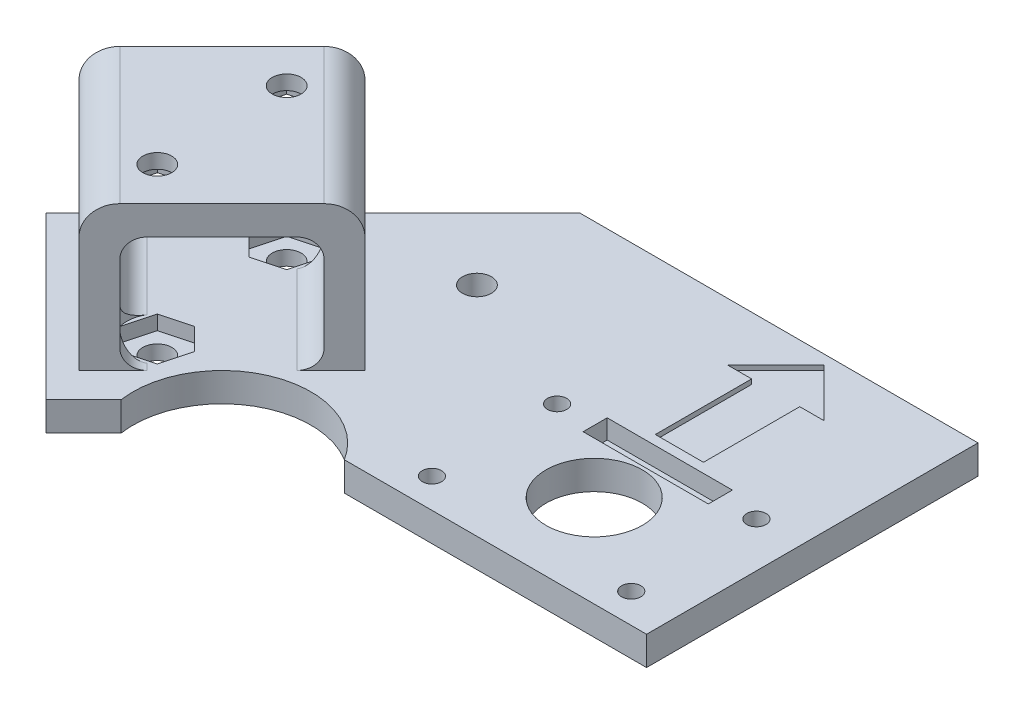
from build123d import *

# Parameters (mm, degrees)
BOSS_EXTRUDE1_DEPTH       = 3
BOSS_EXTRUDE2_DEPTH       = 15
FILLET1_R                 = 3
SKETCH4_W                 = 15
SKETCH4_H                 = 9
SKETCH4_H_2               = 3
CUT_EXTRUDE1_DEPTH        = 135.512351943
FILLET2_R                 = 2
FILLET4_R                 = 2
SKETCH6_R                 = 1.5
CUT_EXTRUDE2_DEPTH        = 3
SKETCH25_R                = 1.5
CUT_EXTRUDE16_DEPTH       = 3
SKETCH7_R                 = 1.5
CUT_EXTRUDE3_DEPTH        = 3
CIRPATTERN1_START         = -3.2499999
CIRPATTERN1_OUTLINE_W     = 20
CIRPATTERN1_OUTLINE_H     = 3
CIRPATTERN1_DEPTH         = 6.4999998
CIRPATTERN1_START_2       = 6.25
CIRPATTERN1_2_OUTLINE_W   = 20
CIRPATTERN1_2_OUTLINE_H   = 3
CIRPATTERN1_2_DEPTH       = 1.25
CIRPATTERN1_START_3       = -7.5
CIRPATTERN1_3_OUTLINE_W   = 20
CIRPATTERN1_3_OUTLINE_H   = 3
CIRPATTERN1_3_DEPTH       = 1.2499999
CIRPATTERN1_START_4       = -10.5
CIRPATTERN1_4_OUTLINE_W   = 20
CIRPATTERN1_4_OUTLINE_H   = 3
CIRPATTERN1_4_DEPTH       = 21
CIRPATTERN1_START_5       = 43.5
CIRPATTERN1_5_OUTLINE_W   = 3.0000002
CIRPATTERN1_5_OUTLINE_H   = 3
CIRPATTERN1_5_OUTLINE_W_2 = 3.0000001
CIRPATTERN1_5_DEPTH       = 20
CIRPATTERN1_6_DEPTH       = 20
CIRPATTERN1_START_6       = -63.5
CIRPATTERN1_7_DEPTH       = 20
CIRPATTERN1_8_DEPTH       = 20
CIRPATTERN1_START_7       = -64
CIRPATTERN1_9_DEPTH       = 128
CIRPATTERN1_START_8       = 15
CIRPATTERN1_10_OUTLINE_R  = 1.5
CIRPATTERN1_10_DEPTH      = 3
CIRPATTERN6_COUNT         = 4
SKETCH8_W                 = 5
SKETCH8_H                 = 10
CUT_EXTRUDE4_DEPTH        = 0.5
SKETCH11_R                = 5
CUT_EXTRUDE6_DEPTH        = 92.046691318
SKETCH12_R                = 1
CUT_EXTRUDE7_DEPTH        = 92.046691318
SKETCH26_W                = 13
SKETCH26_H                = 2.5
CUT_EXTRUDE17_DEPTH       = 2
SKETCH13_W                = 117
SKETCH13_H                = 5
SKETCH13_W_2              = 5
SKETCH13_H_2              = 52.605122422
BOSS_EXTRUDE3_DEPTH       = 6.6
SKETCH14_W                = 5
SKETCH14_H                = 5
BOSS_EXTRUDE4_DEPTH       = 8.5
SKETCH15_W                = 3
SKETCH15_H                = 5
BOSS_EXTRUDE5_DEPTH       = 5
SKETCH16_R                = 1.5
CUT_EXTRUDE8_DEPTH        = 5
FILLET3_R                 = 1
SKETCH17_R                = 2.5
BOSS_EXTRUDE6_DEPTH       = 5
SKETCH18_R                = 1.5
CUT_EXTRUDE9_DEPTH        = 97.520723163
CUT_EXTRUDE10_REACH       = 98.48
SKETCH19_W                = 20
SKETCH19_H                = 50
SKETCH20_R                = 1.5
CUT_EXTRUDE11_DEPTH       = 98.16609491
CUT_EXTRUDE12_DEPTH       = 98.16609491
CUT_EXTRUDE13_DEPTH       = 98.16609491
CUT_EXTRUDE13_DEPTH_BACK  = 98.16609491
SKETCH22_R                = 9.231493399
CUT_EXTRUDE18_DEPTH       = 98.67420335
CUT_EXTRUDE18_DEPTH_BACK  = 98.67420335
SKETCH28_R                = 1.5
CUT_EXTRUDE19_DEPTH       = 1.5
SKETCH23_R                = 1.5
CUT_EXTRUDE14_DEPTH       = 3
CUT_EXTRUDE20_DEPTH       = 1.5
SKETCH24_R                = 3.175426481
CUT_EXTRUDE15_DEPTH       = 3
CUT_EXTRUDE21_START       = -1.5
CUT_EXTRUDE21_DEPTH       = 2.5
CUT_EXTRUDE22_DEPTH       = 1.5
SKETCH33_R                = 3.175426481
CUT_EXTRUDE23_DEPTH       = 3
CUT_EXTRUDE24_START       = -1.5
CUT_EXTRUDE24_DEPTH       = 2.5
CIRPATTERN10_COUNT        = 4
CUT_EXTRUDE25_DEPTH       = 1.5
CUT_EXTRUDE26_DEPTH       = 1.5
CUT_EXTRUDE27_DEPTH       = 2.5
CUT_EXTRUDE28_DEPTH       = 98.67420335
CUT_EXTRUDE28_DEPTH_BACK  = 98.67420335
SKETCH37_R                = 1.5


with BuildPart() as part:
    # Sketch2 → Boss-Extrude1 (new body)
    with BuildSketch(Plane(origin=(0, 0, 0), x_dir=(1, 0, 0), z_dir=(0, 1, 0))):
        Polygon((26.302561211, -63.5), (63.5, -26.302561211), (63.5, 26.302561211), (26.302561211, 63.5), (-26.302561211, 63.5), (-63.5, 26.302561211), (-63.5, -26.302561211), (-26.302561211, -63.5), align=None)
    extrude(amount=BOSS_EXTRUDE1_DEPTH)

    # Sketch3 → Boss-Extrude2 (add)
    with BuildSketch(Plane(origin=(0, 3, 0), x_dir=(1, 0, 0), z_dir=(0, 1, 0))):
        Polygon((-52.325901808, -37.476659403), (-37.476659403, -52.325901808), (-23.334523779, -38.183766184), (-38.183766184, -23.334523779), align=None)
    extrude(amount=BOSS_EXTRUDE2_DEPTH)

    # Fillet1
    fillet1_edges = [part.edges().sort_by_distance(p)[0] for p in [
        (-45.254833996, 18, 30.405591591),
        (-30.405591591, 18, 45.254833996),
    ]]
    fillet(fillet1_edges, radius=FILLET1_R)

    # Sketch4 → Cut-Extrude1 (cut, through all)
    with BuildSketch(Plane(origin=(-30.759144982, 0, 30.759144982), x_dir=(-0.7071067811865479, 0, -0.7071067811865472), z_dir=(0.7071067811865472, 0, -0.7071067811865479))):
        with Locations((0, 10.5)):
            Rectangle(SKETCH4_W, SKETCH4_H)
        with Locations((0, 4.5)):
            Rectangle(SKETCH4_W, SKETCH4_H_2)
    extrude(amount=-CUT_EXTRUDE1_DEPTH, mode=Mode.SUBTRACT)

    # Fillet2
    fillet2_edges = [part.edges().sort_by_distance(p)[0] for p in [
        (-32.526911935, 3, 43.133513652),
        (-43.133513652, 3, 32.526911935),
    ]]
    fillet(fillet2_edges, radius=FILLET2_R)

    # Fillet4
    fillet4_edges = [part.edges().sort_by_distance(p)[0] for p in [
        (-32.526911935, 15, 43.133513652),
        (-43.133513652, 15, 32.526911935),
    ]]
    fillet(fillet4_edges, radius=FILLET4_R)

    # Sketch6 → Cut-Extrude2 (cut)
    with BuildSketch(Plane(origin=(7.424621202, 0, 7.424621202), x_dir=(0.7071067811865472, 0, -0.7071067811865478), z_dir=(0.7071067811865478, 0, 0.7071067811865472))):
        with Locations((-58.5, 10.5)):
            Circle(SKETCH6_R)
    cut_extrude2 = extrude(amount=-CUT_EXTRUDE2_DEPTH, mode=Mode.SUBTRACT)

    # Sketch25 → Cut-Extrude16 (cut)
    with BuildSketch(Plane(origin=(-7.424621202, 0, -7.424621202), x_dir=(-0.7071067811865471, 0, 0.7071067811865479), z_dir=(-0.7071067811865479, 0, -0.7071067811865471))):
        with Locations((48.5, 10.5)):
            Circle(SKETCH25_R)
    cut_extrude16 = extrude(amount=-CUT_EXTRUDE16_DEPTH, mode=Mode.SUBTRACT)

    # Sketch7 → Cut-Extrude3 (cut)
    with BuildSketch(Plane(origin=(0, 18, 0), x_dir=(1, 0, 0), z_dir=(0, 1, 0))):
        with Locations(Location((-44.72450391, -38.006989489, 0), (0, 0, 270))):
            Circle(SKETCH7_R)
        with Locations(Location((-30.935921677, -37.653436098, 0), (0, 0, 270))):
            Circle(SKETCH7_R)
    extrude(amount=-CUT_EXTRUDE3_DEPTH, mode=Mode.SUBTRACT)



with BuildPart() as body_2:
    # CirPattern1: read off the stored shape, not the designer's step
    # CirPattern1 outline → CirPattern1 (new body)
    with BuildSketch(Plane(origin=(0, 0, 0), x_dir=(0.707106781186549, 0, -0.707106781186546), z_dir=(0.707106781186546, 0, 0.707106781186549)).offset(CIRPATTERN1_START)):
        with Locations((53.5, 16.5)):
            Rectangle(CIRPATTERN1_OUTLINE_W, CIRPATTERN1_OUTLINE_H)
    extrude(amount=CIRPATTERN1_DEPTH)



with BuildPart() as body_3:
    # CirPattern1 2 outline → CirPattern1 2 (new body)
    with BuildSketch(Plane(origin=(0, 0, 0), x_dir=(0.707106781186549, 0, -0.707106781186546), z_dir=(0.707106781186546, 0, 0.707106781186549)).offset(CIRPATTERN1_START_2)):
        with Locations((53.5, 16.5)):
            Rectangle(CIRPATTERN1_2_OUTLINE_W, CIRPATTERN1_2_OUTLINE_H)
    extrude(amount=CIRPATTERN1_2_DEPTH)


with BuildPart() as body_4:
    # CirPattern1 3 outline → CirPattern1 3 (new body)
    with BuildSketch(Plane(origin=(0, 0, 0), x_dir=(0.707106781186549, 0, -0.707106781186546), z_dir=(0.707106781186546, 0, 0.707106781186549)).offset(CIRPATTERN1_START_3)):
        with Locations((53.5, 16.5)):
            Rectangle(CIRPATTERN1_3_OUTLINE_W, CIRPATTERN1_3_OUTLINE_H)
    extrude(amount=CIRPATTERN1_3_DEPTH)


with BuildPart() as body_5:
    # CirPattern1 4 outline → CirPattern1 4 (new body)
    with BuildSketch(Plane(origin=(0, 0, 0), x_dir=(0.707106781186548, 0, 0.707106781186547), z_dir=(0.707106781186547, 0, -0.707106781186548)).offset(CIRPATTERN1_START_4)):
        with Locations((53.5, -16.5)):
            Rectangle(CIRPATTERN1_4_OUTLINE_W, CIRPATTERN1_4_OUTLINE_H)
        with Locations((-53.5, -16.5)):
            Rectangle(CIRPATTERN1_4_OUTLINE_W, CIRPATTERN1_4_OUTLINE_H)
    extrude(amount=CIRPATTERN1_4_DEPTH)


with BuildPart() as body_2_1:
    add(body_2.part)

    add(body_3.part)  # CirPattern1 5 merges body 3

    add(body_4.part)  # CirPattern1 5 merges body 4
    # CirPattern1 5 outline → CirPattern1 5 (add)
    with BuildSketch(Plane(origin=(0, 0, 0), x_dir=(0.707106781186548, 0, 0.707106781186547), z_dir=(0.707106781186547, 0, -0.707106781186548)).offset(CIRPATTERN1_START_5)):
        with Locations((-4.75, -16.5)):
            Rectangle(CIRPATTERN1_5_OUTLINE_W, CIRPATTERN1_5_OUTLINE_H)
        with Locations((4.74999995, -16.5)):
            Rectangle(CIRPATTERN1_5_OUTLINE_W_2, CIRPATTERN1_5_OUTLINE_H)
    extrude(amount=CIRPATTERN1_5_DEPTH)


with BuildPart() as part_1:
    add(part.part)

    add(body_2_1.part)  # CirPattern1 6 merges body 2
    # CirPattern1 6 outline → CirPattern1 6 (add)
    with BuildSketch(Plane(origin=(0, 0, 0), x_dir=(0.707106781186548, 0, 0.707106781186547), z_dir=(0.707106781186547, 0, -0.707106781186548)).offset(CIRPATTERN1_START_5)):
        with BuildLine():
            Line((-10.5, -3), (-10.5, -15))
            ThreePointArc((-10.5, -15), (-9.621320344, -17.121320344), (-7.5, -18))
            Line((-7.5, -18), (-7.5, -15))
            Line((-7.5, -15), (-5.5, -15))
            ThreePointArc((-5.5, -15), (-6.914213562, -14.414213562), (-7.5, -13))
            Line((-7.5, -13), (-7.5, -5))
            ThreePointArc((-7.5, -5), (-6.914213562, -3.585786438), (-5.5, -3))
            Line((-5.5, -3), (-10.5, -3))
        make_face()
        with BuildLine():
            Line((7.5, -15), (7.5, -18))
            ThreePointArc((7.5, -18), (9.621320344, -17.121320344), (10.5, -15))
            Line((10.5, -15), (10.5, -3))
            Line((10.5, -3), (5.5, -3))
            ThreePointArc((5.5, -3), (6.914213562, -3.585786438), (7.5, -5))
            Line((7.5, -5), (7.5, -13))
            ThreePointArc((7.5, -13), (6.914213562, -14.414213562), (5.5, -15))
            Line((5.5, -15), (7.5, -15))
        make_face()
    extrude(amount=CIRPATTERN1_6_DEPTH)


    add(body_5.part)  # CirPattern1 7 merges body 5
    # CirPattern1 7 outline → CirPattern1 7 (add)
    with BuildSketch(Plane(origin=(0, 0, 0), x_dir=(0.707106781186549, 0, -0.707106781186546), z_dir=(0.707106781186546, 0, 0.707106781186549)).offset(CIRPATTERN1_START_6)):
        with BuildLine():
            Line((10.5, 3), (10.5, 15))
            Line((10.5, 15), (5.5, 15))
            ThreePointArc((5.5, 15), (6.914213562, 14.414213562), (7.5, 13))
            Line((7.5, 13), (7.5, 5))
            ThreePointArc((7.5, 5), (6.914213562, 3.585786438), (5.5, 3))
            Line((5.5, 3), (10.5, 3))
        make_face()
        with BuildLine():
            Line((-10.5, 3), (-5.5, 3))
            ThreePointArc((-5.5, 3), (-6.914213562, 3.585786438), (-7.5, 5))
            Line((-7.5, 5), (-7.5, 13))
            ThreePointArc((-7.5, 13), (-6.914213562, 14.414213562), (-5.5, 15))
            Line((-5.5, 15), (-10.5, 15))
            Line((-10.5, 15), (-10.5, 3))
        make_face()
    extrude(amount=CIRPATTERN1_7_DEPTH)

    # CirPattern1 8 outline → CirPattern1 8 (add)
    with BuildSketch(Plane(origin=(0, 0, 0), x_dir=(0.707106781186549, 0, -0.707106781186546), z_dir=(0.707106781186546, 0, 0.707106781186549)).offset(CIRPATTERN1_START_5)):
        with BuildLine():
            Line((10.5, 3), (10.5, 15))
            Line((10.5, 15), (5.5, 15))
            ThreePointArc((5.5, 15), (6.914213562, 14.414213562), (7.5, 13))
            Line((7.5, 13), (7.5, 5))
            ThreePointArc((7.5, 5), (6.914213562, 3.585786438), (5.5, 3))
            Line((5.5, 3), (10.5, 3))
        make_face()
        with BuildLine():
            Line((-10.5, 3), (-5.5, 3))
            ThreePointArc((-5.5, 3), (-6.914213562, 3.585786438), (-7.5, 5))
            Line((-7.5, 5), (-7.5, 13))
            ThreePointArc((-7.5, 13), (-6.914213562, 14.414213562), (-5.5, 15))
            Line((-5.5, 15), (-10.5, 15))
            Line((-10.5, 15), (-10.5, 3))
        make_face()
    extrude(amount=CIRPATTERN1_8_DEPTH)

    # CirPattern1 9 outline → CirPattern1 9 (cut)
    with BuildSketch(Plane(origin=(0, 0, 0), x_dir=(0.707106781186549, 0, -0.707106781186546), z_dir=(0.707106781186546, 0, 0.707106781186549)).offset(CIRPATTERN1_START_7)):
        with BuildLine():
            ThreePointArc((7.5, 18), (9.621320344, 17.121320344), (10.5, 15))
            Line((10.5, 15), (10.5, 18))
            Line((10.5, 18), (7.5, 18))
        make_face()
        with BuildLine():
            ThreePointArc((-10.5, 15), (-9.621320344, 17.121320344), (-7.5, 18))
            Line((-7.5, 18), (-10.5, 18))
            Line((-10.5, 18), (-10.5, 15))
        make_face()
    extrude(amount=CIRPATTERN1_9_DEPTH, mode=Mode.SUBTRACT)

    # CirPattern1 10 outline → CirPattern1 10 (cut)
    with BuildSketch(Plane(origin=(0, 0, 0), x_dir=(1, 0, 0), z_dir=(0, 1, 0)).offset(CIRPATTERN1_START_8)):
        with Locations((38.006989489, -44.72450391)):
            Circle(CIRPATTERN1_10_OUTLINE_R)
        with Locations((37.653436098, -30.935921677)):
            Circle(CIRPATTERN1_10_OUTLINE_R)
        with Locations((44.72450391, 38.006989489)):
            Circle(CIRPATTERN1_10_OUTLINE_R)
        with Locations((30.935921677, 37.653436098)):
            Circle(CIRPATTERN1_10_OUTLINE_R)
        with Locations((-38.006989489, 44.72450391)):
            Circle(CIRPATTERN1_10_OUTLINE_R)
        with Locations((-37.653436098, 30.935921677)):
            Circle(CIRPATTERN1_10_OUTLINE_R)
    extrude(amount=CIRPATTERN1_10_DEPTH, mode=Mode.SUBTRACT)

    # CirPattern6: Cut-Extrude2, Cut-Extrude16 ×4 about axis
    cirpattern6_axis = Axis((0, 0, 0), (0, 1, 0))
    add([cut_extrude2.rotate(cirpattern6_axis, i * 360 / CIRPATTERN6_COUNT) for i in range(1, CIRPATTERN6_COUNT)], mode=Mode.SUBTRACT)
    add([cut_extrude16.rotate(cirpattern6_axis, i * 360 / CIRPATTERN6_COUNT) for i in range(1, CIRPATTERN6_COUNT)], mode=Mode.SUBTRACT)

    # Sketch8 → Cut-Extrude4 (cut)
    with BuildSketch(Plane(origin=(0, 3, 0), x_dir=(1, 0, 0), z_dir=(0, 1, 0))):
        with Locations((0, 52.5)):
            Rectangle(SKETCH8_W, SKETCH8_H)
        Polygon((-5, 57.5), (5, 57.5), (0, 62.5), align=None)
    extrude(amount=-CUT_EXTRUDE4_DEPTH, mode=Mode.SUBTRACT)

    # Sketch11 → Cut-Extrude6 (cut, through all)
    with BuildSketch(Plane(origin=(0, 3, 0), x_dir=(1, 0, 0), z_dir=(0, 1, 0))):
        with Locations(Location((0, 38.65, 0), (0, 0, 270))):
            Circle(SKETCH11_R)
    extrude(amount=-CUT_EXTRUDE6_DEPTH, mode=Mode.SUBTRACT)

    # Sketch12 → Cut-Extrude7 (cut, through all)
    with BuildSketch(Plane(origin=(0, 3, 0), x_dir=(1, 0, 0), z_dir=(0, 1, 0))):
        with Locations(Location((-10.35, 45.15, 0), (0, 0, 270))):
            Circle(SKETCH12_R)
        with Locations(Location((10.35, 45.15, 0), (0, 0, 90))):
            Circle(SKETCH12_R)
        with Locations(Location((-10.35, 32.15, 0), (0, 0, 270))):
            Circle(SKETCH12_R)
        with Locations(Location((10.35, 32.15, 0), (0, 0, 90))):
            Circle(SKETCH12_R)
    extrude(amount=-CUT_EXTRUDE7_DEPTH, mode=Mode.SUBTRACT)

    # Sketch26 → Cut-Extrude17 (cut)
    with BuildSketch(Plane(origin=(0, 3, 0), x_dir=(1, 0, 0), z_dir=(0, 1, 0))):
        with Locations((0, 45.25)):
            Rectangle(SKETCH26_W, SKETCH26_H)
    extrude(amount=-CUT_EXTRUDE17_DEPTH, mode=Mode.SUBTRACT)

    # Sketch13 → Boss-Extrude3 (add)
    with BuildSketch(Plane(origin=(0, 3, 0), x_dir=(1, 0, 0), z_dir=(0, 1, 0))):
        with Locations((0, -12.5)):
            Rectangle(SKETCH13_W, SKETCH13_H)
        with Locations((-61, 0)):
            Rectangle(SKETCH13_W_2, SKETCH13_H_2)
        with Locations((0, 12.5)):
            Rectangle(SKETCH13_W, SKETCH13_H)
        with Locations((61, 0)):
            Rectangle(SKETCH13_W_2, SKETCH13_H_2)
    extrude(amount=BOSS_EXTRUDE3_DEPTH)

    # Sketch14 → Boss-Extrude4 (add)
    with BuildSketch(Plane(origin=(63.5, 0, 0), x_dir=(0, 0, -1), z_dir=(1, 0, 0))):
        with Locations((0, 7.1)):
            Rectangle(SKETCH14_W, SKETCH14_H)
    extrude(amount=BOSS_EXTRUDE4_DEPTH)

    # Sketch15 → Boss-Extrude5 (add)
    with BuildSketch(Plane(origin=(0, 9.6, 0), x_dir=(1, 0, 0), z_dir=(0, 1, 0))):
        with Locations((70.5, 0)):
            Rectangle(SKETCH15_W, SKETCH15_H)
    extrude(amount=BOSS_EXTRUDE5_DEPTH)

    # Sketch16 → Cut-Extrude8 (cut)
    with BuildSketch(Plane.ZY.offset(63.5)):
        with Locations((-5, 5.8)):
            Circle(SKETCH16_R)
        with Locations(Location((5, 5.8, 0), (0, 0, 180))):
            Circle(SKETCH16_R)
    extrude(amount=-CUT_EXTRUDE8_DEPTH, mode=Mode.SUBTRACT)

    # Fillet3
    fillet3_edges = [part_1.edges().sort_by_distance(p)[0] for p in [
        (0, 9.6, -15),
        (-58.5, 9.6, -20.651280605),
        (-61, 9.6, -26.302561211),
        (-58.5, 9.6, 20.651280605),
        (61, 9.6, 26.302561211),
        (63.5, 9.6, -14.401280605),
        (-58.5, 9.6, 0),
        (0, 9.6, 10),
        (0, 9.6, -10),
        (58.5, 9.6, 0),
        (-63.5, 9.6, 0),
        (-61, 9.6, 26.302561211),
        (0, 9.6, 15),
        (58.5, 9.6, 20.651280605),
        (61, 9.6, -26.302561211),
        (58.5, 9.6, -20.651280605),
        (63.5, 9.6, 14.401280605),
        (63.5, 7.1, -2.5),
        (67.75, 4.6, -2.5),
        (63.5, 7.1, 2.5),
        (63.5, 4.6, 0),
        (67.75, 4.6, 2.5),
        (72, 9.6, -2.5),
        (72, 9.6, 2.5),
        (72, 4.6, 0),
        (66.25, 9.6, 2.5),
        (66.25, 9.6, -2.5),
        (69, 9.6, 0),
        (69, 12.1, -2.5),
        (69, 12.1, 2.5),
        (72, 14.6, 0),
        (70.5, 14.6, -2.5),
        (69, 14.6, 0),
        (70.5, 14.6, 2.5),
    ]]
    fillet(fillet3_edges, radius=FILLET3_R)

    # Sketch17 → Boss-Extrude6 (add)
    with BuildSketch(Plane(origin=(0, 3, 0), x_dir=(1, 0, 0), z_dir=(0, 1, 0))):
        with Locations(Location((-15, -31, 0), (0, 0, 270))):
            Circle(SKETCH17_R)
        with Locations(Location((-15, -61, 0), (0, 0, 270))):
            Circle(SKETCH17_R)
        with Locations(Location((15, -61, 0), (0, 0, 270))):
            Circle(SKETCH17_R)
        with Locations(Location((15, -31, 0), (0, 0, 270))):
            Circle(SKETCH17_R)
    extrude(amount=BOSS_EXTRUDE6_DEPTH)

    # Sketch18 → Cut-Extrude9 (cut, through all)
    with BuildSketch(Plane(origin=(0, 8, 0), x_dir=(1, 0, 0), z_dir=(0, 1, 0))):
        with Locations(Location((-15, -31, 0), (0, 0, 270))):
            Circle(SKETCH18_R)
        with Locations(Location((15, -31, 0), (0, 0, 270))):
            Circle(SKETCH18_R)
        with Locations(Location((15, -61, 0), (0, 0, 270))):
            Circle(SKETCH18_R)
        with Locations(Location((-15, -61, 0), (0, 0, 270))):
            Circle(SKETCH18_R)
    extrude(amount=-CUT_EXTRUDE9_DEPTH, mode=Mode.SUBTRACT)

    # Cut-Extrude10: up to this face of the body (flat: up to its plane)
    cut_extrude10_end = Plane(part_1.part.faces().sort_by_distance((0, 3, 35.842602054))[0])
    # Sketch19 → Cut-Extrude10 (cut, up to the picked face)
    with BuildSketch(Plane(origin=(0, 9.6, 0), x_dir=(1, 0, 0), z_dir=(0, 1, 0)), mode=Mode.PRIVATE) as cut_extrude10_sk1:
        Rectangle(SKETCH19_W, SKETCH19_H)
    cut_extrude10_tool1 = split(extrude(cut_extrude10_sk1.sketch, amount=-CUT_EXTRUDE10_REACH, mode=Mode.PRIVATE), bisect_by=cut_extrude10_end, keep=Keep.BOTH, mode=Mode.PRIVATE)
    add(cut_extrude10_tool1.solids().sort_by(Axis((0, 9.6, 0), (0, -1, 0)))[0], mode=Mode.SUBTRACT)

    # Sketch20 → Cut-Extrude11 (cut, through all)
    with BuildSketch(Plane(origin=(0, 3, 0), x_dir=(1, 0, 0), z_dir=(0, 1, 0))):
        with Locations(Location((51.680657662, -25.20634094, 0), (0, 0, 270))):
            Circle(SKETCH20_R)
        with Locations(Location((25.20634094, -51.680657662, 0), (0, 0, 270))):
            Circle(SKETCH20_R)
        with Locations(Location((-51.680657662, -25.20634094, 0), (0, 0, 270))):
            Circle(SKETCH20_R)
        with Locations(Location((-25.20634094, -51.680657662, 0), (0, 0, 270))):
            Circle(SKETCH20_R)
        with Locations(Location((-25.20634094, 51.680657662, 0), (0, 0, 270))):
            Circle(SKETCH20_R)
        with Locations(Location((-51.680657662, 25.20634094, 0), (0, 0, 270))):
            Circle(SKETCH20_R)
        with Locations(Location((51.680657662, 25.20634094, 0), (0, 0, 270))):
            Circle(SKETCH20_R)
        with Locations(Location((25.20634094, 51.680657662, 0), (0, 0, 270))):
            Circle(SKETCH20_R)
    extrude(amount=-CUT_EXTRUDE11_DEPTH, mode=Mode.SUBTRACT)

    # Sketch21 → Cut-Extrude12 (cut, through all)
    with BuildSketch(Plane(origin=(0, 3, 0), x_dir=(1, 0, 0), z_dir=(0, 1, 0))):
        with BuildLine():
            Line((-49.75, 7.5), (-19.75, 7.5))
            ThreePointArc((-19.75, 7.5), (-12.25, 0), (-19.75, -7.5))
            Line((-19.75, -7.5), (-49.75, -7.5))
            ThreePointArc((-49.75, -7.5), (-57.25, 0), (-49.75, 7.5))
        make_face()
        with BuildLine():
            Line((49.75, 7.5), (19.75, 7.5))
            ThreePointArc((19.75, 7.5), (12.25, 0), (19.75, -7.5))
            Line((19.75, -7.5), (49.75, -7.5))
            ThreePointArc((49.75, -7.5), (57.25, 0), (49.75, 7.5))
        make_face()
    extrude(amount=-CUT_EXTRUDE12_DEPTH, mode=Mode.SUBTRACT)

    # Sketch22 → Cut-Extrude13 (cut, two sides: drawn at the far end of the back side and taken through both)
    with BuildSketch(Plane(origin=(0, 3, 0), x_dir=(1, 0, 0), z_dir=(0, 1, 0)).offset(-CUT_EXTRUDE13_DEPTH_BACK)):
        with Locations(Location((-24.231493399, -24.231493399, 0), (0, 0, 270))):
            Circle(SKETCH22_R)
        with Locations(Location((-24.231493399, 24.231493399, 0), (0, 0, 270))):
            Circle(SKETCH22_R)
        with Locations(Location((24.231493399, 24.231493399, 0), (0, 0, 270))):
            Circle(SKETCH22_R)
        with Locations(Location((24.231493399, -24.231493399, 0), (0, 0, 270))):
            Circle(SKETCH22_R)
    extrude(amount=CUT_EXTRUDE13_DEPTH + CUT_EXTRUDE13_DEPTH_BACK, mode=Mode.SUBTRACT)

    # Sketch28 → Cut-Extrude18 (cut, two sides: drawn at the far end of the back side and taken through both)
    with BuildSketch(Plane.XZ.offset(-CUT_EXTRUDE18_DEPTH_BACK)):
        with Locations(Location((-6.387138789, 53.9635, 0), (0, 0, 90))):
            Circle(SKETCH28_R)
        with Locations(Location((-0.430238789, -21.8261, 0), (0, 0, 90))):
            Circle(SKETCH28_R)
    extrude(amount=CUT_EXTRUDE18_DEPTH + CUT_EXTRUDE18_DEPTH_BACK, mode=Mode.SUBTRACT)

    # Sketch29 → Cut-Extrude19 (cut)
    with BuildSketch(Plane(origin=(0, 3, 0), x_dir=(1, 0, 0), z_dir=(0, 1, 0))):
        Polygon((-4.799425549, -56.7135), (-3.211712309, -53.9635), (-4.799425549, -51.2135), (-7.97485203, -51.2135), (-9.56256527, -53.9635), (-7.97485203, -56.7135), align=None)
        Polygon((1.157474451, 19.0761), (2.745187691, 21.8261), (1.157474451, 24.5761), (-2.01795203, 24.5761), (-3.60566527, 21.8261), (-2.01795203, 19.0761), align=None)
    extrude(amount=-CUT_EXTRUDE19_DEPTH, mode=Mode.SUBTRACT)

    # Sketch23 → Cut-Extrude14 (cut, symmetric)
    with BuildSketch(Plane(origin=(0, 3, 0), x_dir=(1, 0, 0), z_dir=(0, 1, 0))):
        with Locations(Location((-45.431610691, -38.71409627, 0), (0, 0, 75))):
            Circle(SKETCH23_R)
        with Locations(Location((-30.228814896, -36.946329317, 0), (0, 0, 15))):
            Circle(SKETCH23_R)
    cut_extrude14 = extrude(amount=CUT_EXTRUDE14_DEPTH, both=True, mode=Mode.SUBTRACT)

    # Sketch30 → Cut-Extrude20 (cut)
    with BuildSketch(Plane(origin=(0, 3, 0), x_dir=(1, 0, 0), z_dir=(0, 1, 0))):
        Polygon((-44.609749842, -41.781322717), (-42.364384244, -39.535957119), (-43.186245094, -36.468730672), (-46.253471541, -35.646869823), (-48.498837138, -37.89223542), (-47.676976289, -40.959461868), align=None)
        Polygon((-32.474180493, -39.191694915), (-29.406954046, -40.013555764), (-27.161588449, -37.768190166), (-27.983449298, -34.700963719), (-31.050675745, -33.87910287), (-33.296041343, -36.124468468), align=None)
    cut_extrude20 = extrude(amount=-CUT_EXTRUDE20_DEPTH, mode=Mode.SUBTRACT)

    # Sketch24 → Cut-Extrude15 (cut)
    with BuildSketch(Plane(origin=(0, 3, 0), x_dir=(1, 0, 0), z_dir=(0, 1, 0))):
        with Locations((-45.431610691, -38.71409627)):
            Circle(SKETCH24_R)
        with Locations((-30.228814896, -36.946329317)):
            Circle(SKETCH24_R)
    cut_extrude15 = extrude(amount=CUT_EXTRUDE15_DEPTH, mode=Mode.SUBTRACT)

    # Sketch31 → Cut-Extrude21 (cut)
    with BuildSketch(Plane(origin=(-5.303300859, 0, 5.303300859), x_dir=(-0.7071067811865406, 0, -0.7071067811865546), z_dir=(0.7071067811865546, 0, -0.7071067811865406)).offset(CUT_EXTRUDE21_START)):
        Polygon((-46.883419246, 7.7), (-45.266838493, 10.5), (-46.883419246, 13.3), (-50.116580754, 13.3), (-51.733161507, 10.5), (-50.116580754, 7.7), align=None)
    cut_extrude21 = extrude(amount=CUT_EXTRUDE21_DEPTH, mode=Mode.SUBTRACT)

    # Sketch32 → Cut-Extrude22 (cut)
    with BuildSketch(Plane.XZ.offset(-15)):
        Polygon((35.761623891, 42.479138312), (38.828850338, 41.657277463), (41.074215936, 43.902643061), (40.252355086, 46.969869508), (37.185128639, 47.791730357), (34.939763042, 45.54636476), align=None)
        Polygon((39.898801696, 33.181287274), (36.831575249, 34.003148124), (34.586209651, 31.757782526), (35.408070501, 28.690556079), (38.475296948, 27.86869523), (40.720662545, 30.114060827), align=None)
    cut_extrude22 = extrude(amount=-CUT_EXTRUDE22_DEPTH, mode=Mode.SUBTRACT)

    # Sketch33 → Cut-Extrude23 (cut)
    with BuildSketch(Plane.XZ.offset(-15)):
        with Locations((38.006989489, 44.72450391)):
            Circle(SKETCH33_R)
        with Locations((37.653436098, 30.935921677)):
            Circle(SKETCH33_R)
    cut_extrude23 = extrude(amount=CUT_EXTRUDE23_DEPTH, mode=Mode.SUBTRACT)

    # Sketch34 → Cut-Extrude24 (cut)
    with BuildSketch(Plane(origin=(5.303300859, 0, -5.303300859), x_dir=(0.7071067811865406, 0, 0.7071067811865546), z_dir=(-0.7071067811865546, 0, 0.7071067811865406)).offset(CUT_EXTRUDE24_START)):
        Polygon((60.116580754, 7.7), (61.733161507, 10.5), (60.116580754, 13.3), (56.883419246, 13.3), (55.266838493, 10.5), (56.883419246, 7.7), align=None)
    cut_extrude24 = extrude(amount=CUT_EXTRUDE24_DEPTH, mode=Mode.SUBTRACT)

    # CirPattern10: Cut-Extrude14, Cut-Extrude20, Cut-Extrude15, Cut-Extrude21, Cut-Extrude22, Cut-Extrude23, Cut-Extrude24 ×4 about axis
    cirpattern10_axis = Axis((0, 0, 0), (0, 1, 0))
    add([cut_extrude14.rotate(cirpattern10_axis, i * 360 / CIRPATTERN10_COUNT) for i in range(1, CIRPATTERN10_COUNT)], mode=Mode.SUBTRACT)
    add([cut_extrude20.rotate(cirpattern10_axis, i * 360 / CIRPATTERN10_COUNT) for i in range(1, CIRPATTERN10_COUNT)], mode=Mode.SUBTRACT)
    add([cut_extrude15.rotate(cirpattern10_axis, i * 360 / CIRPATTERN10_COUNT) for i in range(1, CIRPATTERN10_COUNT)], mode=Mode.SUBTRACT)
    add([cut_extrude21.rotate(cirpattern10_axis, i * 360 / CIRPATTERN10_COUNT) for i in range(1, CIRPATTERN10_COUNT)], mode=Mode.SUBTRACT)
    add([cut_extrude22.rotate(cirpattern10_axis, i * 360 / CIRPATTERN10_COUNT) for i in range(1, CIRPATTERN10_COUNT)], mode=Mode.SUBTRACT)
    add([cut_extrude23.rotate(cirpattern10_axis, i * 360 / CIRPATTERN10_COUNT) for i in range(1, CIRPATTERN10_COUNT)], mode=Mode.SUBTRACT)
    add([cut_extrude24.rotate(cirpattern10_axis, i * 360 / CIRPATTERN10_COUNT) for i in range(1, CIRPATTERN10_COUNT)], mode=Mode.SUBTRACT)

    # Sketch35 → Cut-Extrude25 (cut)
    with BuildSketch(Plane.XZ):
        Polygon((-13.41228676, 58.25), (-11.824573519, 61), (-13.41228676, 63.75), (-16.58771324, 63.75), (-18.175426481, 61), (-16.58771324, 58.25), align=None)
        Polygon((16.58771324, 58.25), (18.175426481, 61), (16.58771324, 63.75), (13.41228676, 63.75), (11.824573519, 61), (13.41228676, 58.25), align=None)
        Polygon((-13.41228676, 33.75), (-16.58771324, 33.75), (-18.175426481, 31), (-16.58771324, 28.25), (-13.41228676, 28.25), (-11.824573519, 31), align=None)
        Polygon((13.41228676, 33.75), (11.824573519, 31), (13.41228676, 28.25), (16.58771324, 28.25), (18.175426481, 31), (16.58771324, 33.75), align=None)
    extrude(amount=-CUT_EXTRUDE25_DEPTH, mode=Mode.SUBTRACT)

    # Sketch36 → Cut-Extrude26 (cut)
    with BuildSketch(Plane.XZ):
        Polygon((-9.180865705, -34.175), (-8.01173141, -32.15), (-9.180865705, -30.125), (-11.519134295, -30.125), (-12.68826859, -32.15), (-11.519134295, -34.175), align=None)
        Polygon((11.519134295, -34.175), (12.68826859, -32.15), (11.519134295, -30.125), (9.180865705, -30.125), (8.01173141, -32.15), (9.180865705, -34.175), align=None)
        Polygon((9.180865705, -47.175), (11.519134295, -47.175), (12.68826859, -45.15), (11.519134295, -43.125), (9.180865705, -43.125), (8.01173141, -45.15), align=None)
        Polygon((-9.180865705, -47.175), (-8.01173141, -45.15), (-9.180865705, -43.125), (-11.519134295, -43.125), (-12.68826859, -45.15), (-11.519134295, -47.175), align=None)
    extrude(amount=-CUT_EXTRUDE26_DEPTH, mode=Mode.SUBTRACT)

    # Sketch27 → Cut-Extrude27 (cut)
    with BuildSketch(Plane(origin=(-58.5, 0, 0), x_dir=(0, 0, -1), z_dir=(1, 0, 0))):
        Polygon((-3.41228676, 3.05), (-1.824573519, 5.8), (-3.41228676, 8.55), (-6.58771324, 8.55), (-8.175426481, 5.8), (-6.58771324, 3.05), align=None)
        Polygon((3.383419246, 3), (6.616580754, 3), (8.233161507, 5.8), (6.616580754, 8.6), (3.383419246, 8.6), (1.766838493, 5.8), align=None)
    extrude(amount=-CUT_EXTRUDE27_DEPTH, mode=Mode.SUBTRACT)

    # Sketch37 → Cut-Extrude28 (cut, two sides: drawn at the far end of the back side and taken through both)
    # profile 1 of 4: a face of its own
    with BuildSketch(Plane(origin=(0, 18, 0), x_dir=(1, 0, 0), z_dir=(0, 1, 0)).offset(-CUT_EXTRUDE28_DEPTH_BACK)):
        Polygon((-37.270165537, 18.995055489), (-54.03883563, 35.763725581), (-63.5, 26.302561211), (-63.5, -26.302561211), (-26.302561211, -63.5), (26.302561211, -63.5), (63.5, -26.302561211), (78.885439265, 0), (63.5, 26.302561211), (50.204581464, 39.597979746), (36.062445841, 25.455844123), (25.455844123, 36.062445841), (39.597979746, 50.204581464), (26.302561211, 63.5), (15.008261516, 63.5), (15.008261516, 29.08092566), (-27.184295366, 29.08092566), align=None)
    # profile 2 of 4: a face of its own
    with BuildSketch(Plane(origin=(0, 18, 0), x_dir=(1, 0, 0), z_dir=(0, 1, 0)).offset(-CUT_EXTRUDE28_DEPTH_BACK)):
        Polygon((39.597979746, 50.204581464), (25.455844123, 36.062445841), (36.062445841, 25.455844123), (50.204581464, 39.597979746), align=None)
        with Locations((30.935921677, 37.653436098)):
            Circle(SKETCH37_R, mode=Mode.SUBTRACT)
        with Locations((44.72450391, 38.006989489)):
            Circle(SKETCH37_R, mode=Mode.SUBTRACT)
    # profile 3 of 4: a face of its own
    with BuildSketch(Plane(origin=(0, 18, 0), x_dir=(1, 0, 0), z_dir=(0, 1, 0)).offset(-CUT_EXTRUDE28_DEPTH_BACK)):
        with Locations((44.72450391, 38.006989489)):
            Circle(SKETCH37_R)
    # profile 4 of 4: a face of its own
    with BuildSketch(Plane(origin=(0, 18, 0), x_dir=(1, 0, 0), z_dir=(0, 1, 0)).offset(-CUT_EXTRUDE28_DEPTH_BACK)):
        with Locations((30.935921677, 37.653436098)):
            Circle(SKETCH37_R)
    extrude(amount=CUT_EXTRUDE28_DEPTH + CUT_EXTRUDE28_DEPTH_BACK, mode=Mode.SUBTRACT)


solid = part_1.part
